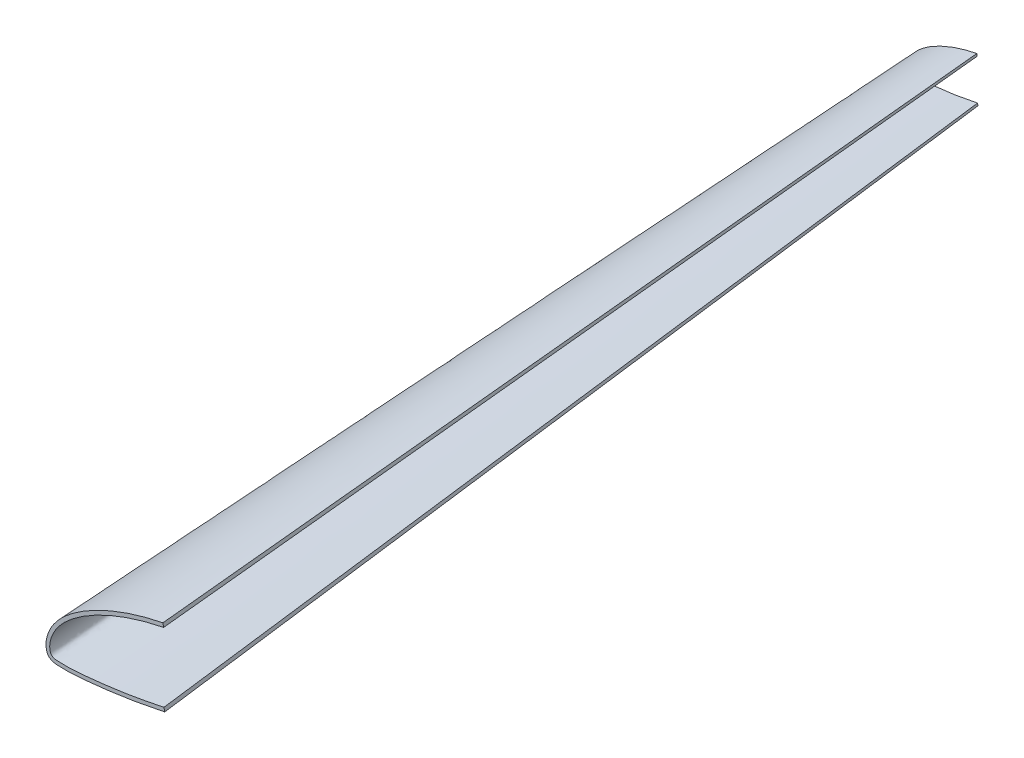
from build123d import *

# Parameters (mm, degrees)
CUT_EXTRUDE5_DEPTH      = 474.768477733
CUT_EXTRUDE5_DEPTH_BACK = 474.768477733


with BuildPart() as part:
    # Boundary1: read off the stored shape, not the designer's step
    # Boundary1: loft between two sections, ruled curve by curve
    boundary1_from = [
        Edge.make_bspline([(27.360981111, 28.798404276, 2.519533902), (24.418912176, 28.222407947, 2.469140753), (18.568950334, 26.885681014, 2.3521923), (9.931603873, 24.382218619, 2.133167721), (1.454173497, 21.359546302, 1.868718159), (-6.825266824, 17.759780001, 1.553779417), (-13.476961936, 14.208429947, 1.243076547), (-18.595650936, 10.966147867, 0.959413621), (-22.295577191, 8.300678028, 0.726215227), (-25.829788091, 5.390370294, 0.471596293), (-29.147742681, 2.109268757, 0.184537105), (-31.555461477, -1.024345123, -0.089618586), (-33.181527352, -3.733383922, -0.32662877), (-34.240367025, -5.892133339, -0.515494871), (-35.079614705, -8.180479819, -0.715699246), (-35.557667228, -10.211613634, -0.893400429), (-35.732624245, -11.933496852, -1.044045691), (-35.721862376, -13.266435266, -1.160662691), (-35.582262474, -14.368851091, -1.257111578), (-35.368251029, -15.3258026, -1.340833987), (-35.0906666, -16.132151014, -1.411380332), (-34.612779787, -16.99853864, -1.487179427), (-33.836646855, -17.786101063, -1.556082211), (-33.042092756, -18.274548007, -1.598815782), (-32.003372281, -18.71392924, -1.637256659), (-30.818177722, -18.991763726, -1.661564026), (-29.490238689, -19.12069101, -1.672843702), (-28.340965262, -19.151893596, -1.675573575), (-26.85641179, -19.192859572, -1.679157633), (-24.952158992, -19.217061473, -1.681275025), (-22.656109383, -19.160921412, -1.676363406), (-20.398107438, -19.037546476, -1.665569498), (-18.167525907, -18.884808419, -1.65220665), (-15.192679466, -18.655810801, -1.632171954), (-11.479797979, -18.316684308, -1.60250223), (-7.040502934, -17.838214449, -1.560641542), (-2.6127621, -17.307833798, -1.514239248), (3.278252149, -16.540512399, -1.447107324), (10.649779589, -15.458292083, -1.352425315), (19.442358508, -13.84734437, -1.211485652), (25.243200231, -12.665062916, -1.108049428), (28.148011567, -12.071676603, -1.056134853)], [0, 0, 0, 0, 0.0625, 0.125, 0.1875, 0.25, 0.3125, 0.34375, 0.375, 0.40625, 0.4375, 0.46875, 0.484375, 0.5, 0.515625, 0.53125, 0.5390625, 0.546875, 0.5546875, 0.55859375, 0.5625, 0.56640625, 0.5703125, 0.57421875, 0.578125, 0.5859375, 0.59375, 0.6015625, 0.609375, 0.625, 0.640625, 0.65625, 0.671875, 0.6875, 0.71875, 0.75, 0.78125, 0.8125, 0.875, 0.9375, 1, 1, 1, 1], 3),
        Edge.make_bspline([(27.746461368, -10.120894763, -0.885463557), (24.54048865, -10.775801437, -0.942760466), (18.322219711, -12.043079832, -1.053632959), (9.311879161, -13.657980859, -1.194918492), (0.965035467, -14.852075679, -1.299388252), (-6.604009298, -15.797684151, -1.382118273), (-13.358041741, -16.512375352, -1.444645651), (-19.228055617, -16.981104767, -1.485654161), (-24.147885132, -17.259697087, -1.510027831), (-28.064249619, -17.175918225, -1.50269813), (-30.927663742, -17.073423608, -1.493731013), (-33.069779251, -16.093790181, -1.408024194), (-33.670245564, -14.069692564, -1.230938599), (-33.79784861, -11.855589554, -1.037229685), (-33.330465654, -9.22928314, -0.807457647), (-32.313062195, -6.376911928, -0.557907502), (-30.705815178, -3.365380944, -0.294432681), (-28.516579872, -0.262534408, -0.022968784), (-25.653586837, 2.838080995, 0.248299913), (-22.130293772, 5.909768433, 0.517037742), (-17.998850338, 8.98482223, 0.786070089), (-13.260099319, 11.999245437, 1.049797947), (-7.943462931, 14.912664392, 1.304689077), (-2.077633941, 17.692381046, 1.547882772), (4.319210231, 20.28333514, 1.774561883), (11.207289388, 22.671570188, 1.983505376), (19.047405598, 24.944981537, 2.182403096), (24.631685242, 26.234599221, 2.295230024), (27.746461368, 26.844408051, 2.348581383)], [0, 0, 0, 0, 0.069142211, 0.134093926, 0.193382849, 0.247272805, 0.29525533, 0.336863889, 0.371680257, 0.39933975, 0.419456898, 0.432512713, 0.445408835, 0.461295234, 0.479930086, 0.501308052, 0.525350586, 0.552013073, 0.581539338, 0.614461538, 0.650800476, 0.69040154, 0.733149242, 0.778919637, 0.827558387, 0.878968086, 0.932940996, 1, 1, 1, 1], 3),
        Edge.make_line((27.746461368, 26.844408051, 2.348581383), (27.360981111, 28.798404276, 2.519533902)),
        Edge.make_line((28.148011567, -12.071676603, -1.056134853), (27.746461368, -10.120894763, -0.885463557)),
    ]
    boundary1_to = [
        Edge.make_bspline([(0.958594206, 49.294963017, -467.382191229), (-0.757612673, 48.958965158, -467.411587232), (-4.170090414, 48.179207781, -467.479807163), (-9.208542516, 46.718854717, -467.607571501), (-14.153710236, 44.955629199, -467.761833745), (-18.983383756, 42.855765523, -467.945548012), (-22.863539238, 40.784144658, -468.126791352), (-25.849441155, 38.892813445, -468.292261393), (-28.00773147, 37.337956039, -468.428293789), (-30.069354495, 35.640276527, -468.576821501), (-32.004828006, 33.726300631, -468.744272694), (-33.409330637, 31.898359201, -468.904196846), (-34.357869064, 30.318086568, -469.042452787), (-34.97552554, 29.058816075, -469.15262468), (-35.465086687, 27.723947295, -469.269410565), (-35.743950659, 26.539119236, -469.373069589), (-35.846008918, 25.534687359, -469.460945991), (-35.839731162, 24.75713995, -469.528972575), (-35.758297885, 24.114064053, -469.585234425), (-35.633457875, 23.555842339, -469.634072497), (-35.471533625, 23.085472431, -469.675224532), (-35.192766318, 22.580079649, -469.719440671), (-34.740022107, 22.120668236, -469.759633961), (-34.276532216, 21.835740852, -469.784561877), (-33.67061194, 21.579435133, -469.806985722), (-32.979248447, 21.417365016, -469.82116502), (-32.204617344, 21.342157434, -469.827744831), (-31.534207845, 21.323955925, -469.829337257), (-30.668218319, 21.300059106, -469.831427957), (-29.557404187, 21.28594133, -469.832663103), (-28.218041916, 21.318689699, -469.829797992), (-26.900874114, 21.390658411, -469.823501545), (-25.599701555, 21.479755611, -469.81570655), (-23.864374464, 21.613337555, -469.804019645), (-21.69852693, 21.811161343, -469.786712306), (-19.108938154, 22.090268761, -469.762293571), (-16.526089334, 22.399657474, -469.735225566), (-13.089664355, 22.847261623, -469.696065277), (-8.789606682, 23.478556807, -469.640834105), (-3.660602312, 24.418276307, -469.558619302), (-0.276777974, 25.107940488, -469.498281504), (1.417695305, 25.454082504, -469.467998002)], [0, 0, 0, 0, 0.0625, 0.125, 0.1875, 0.25, 0.3125, 0.34375, 0.375, 0.40625, 0.4375, 0.46875, 0.484375, 0.5, 0.515625, 0.53125, 0.5390625, 0.546875, 0.5546875, 0.55859375, 0.5625, 0.56640625, 0.5703125, 0.57421875, 0.578125, 0.5859375, 0.59375, 0.6015625, 0.609375, 0.625, 0.640625, 0.65625, 0.671875, 0.6875, 0.71875, 0.75, 0.78125, 0.8125, 0.875, 0.9375, 1, 1, 1, 1], 3),
        Edge.make_bspline([(1.183457689, 26.592038577, -469.368439746), (-0.686693063, 26.210009684, -469.401862943), (-4.314016611, 25.470763954, -469.466538564), (-9.570048598, 24.528738355, -469.548955125), (-14.439040753, 23.832183043, -469.609895818), (-18.854316866, 23.280578101, -469.658154997), (-22.794169125, 22.8636749, -469.694629301), (-26.218343885, 22.590249408, -469.718550932), (-29.088244436, 22.427737222, -469.732768906), (-31.372790386, 22.476608224, -469.728493247), (-33.043115292, 22.536396751, -469.723262429), (-34.292682672, 23.107849583, -469.673266785), (-34.642954688, 24.288573194, -469.569966854), (-34.717389798, 25.580133283, -469.456969988), (-34.44474974, 27.112145357, -469.322936299), (-33.851264389, 28.776028565, -469.177365381), (-32.913703629, 30.532754972, -469.023671735), (-31.636649701, 32.342748785, -468.865317796), (-29.96657043, 34.151441103, -468.707077722), (-27.911316142, 35.943258775, -468.550313989), (-25.501307472, 37.737040157, -468.393378453), (-22.737036045, 39.495453694, -468.239537203), (-19.635664819, 41.194948084, -468.09085071), (-16.213931241, 42.816449466, -467.948987721), (-12.482438807, 44.327839354, -467.81675824), (-8.464392632, 45.720976466, -467.694874536), (-3.89099151, 47.047133086, -467.578850865), (-0.633495051, 47.799410068, -467.513035157), (1.183457689, 48.155131885, -467.481913531)], [0, 0, 0, 0, 0.069142211, 0.134093926, 0.193382849, 0.247272805, 0.29525533, 0.336863889, 0.371680257, 0.39933975, 0.419456898, 0.432512713, 0.445408835, 0.461295234, 0.479930086, 0.501308052, 0.525350586, 0.552013073, 0.581539338, 0.614461538, 0.650800476, 0.69040154, 0.733149242, 0.778919637, 0.827558387, 0.878968086, 0.932940996, 1, 1, 1, 1], 3),
        Edge.make_line((1.183457689, 48.155131885, -467.481913531), (0.958594206, 49.294963017, -467.382191229)),
        Edge.make_line((1.417695305, 25.454082504, -469.467998002), (1.183457689, 26.592038577, -469.368439746)),
    ]
    boundary1 = Solid(Shell([*[Face.make_surface_from_curves(boundary1_from[k], boundary1_to[k]) for k in range(4)], Face(Wire(boundary1_from)), Face(Wire(boundary1_to))]))
    add(boundary1)

    # Sketch5 → Cut-Extrude5 (cut, two sides: drawn at the far end of the back side and taken through both)
    with BuildSketch(Plane(origin=(0, 0, 0), x_dir=(1, 0, 0), z_dir=(0, 1, 0)).offset(-CUT_EXTRUDE5_DEPTH_BACK)):
        Polygon((-35.721546653, -8.625910717), (33.819556419, -8.625910717), (28.624276546, -1.901938856), (28.624276546, 5.514944665), (-37.390121525, 5.514944665), (-37.390121525, -8.625910717), align=None)
        Polygon((-34.646925106, 467.494718866), (32.820207059, 467.494718866), (29.698898094, 471.53446151), (29.698898094, 478.951345031), (-36.315499978, 478.951345031), (-36.315499978, 467.494718866), align=None)
    extrude(amount=CUT_EXTRUDE5_DEPTH + CUT_EXTRUDE5_DEPTH_BACK, mode=Mode.SUBTRACT)


solid = part.part
